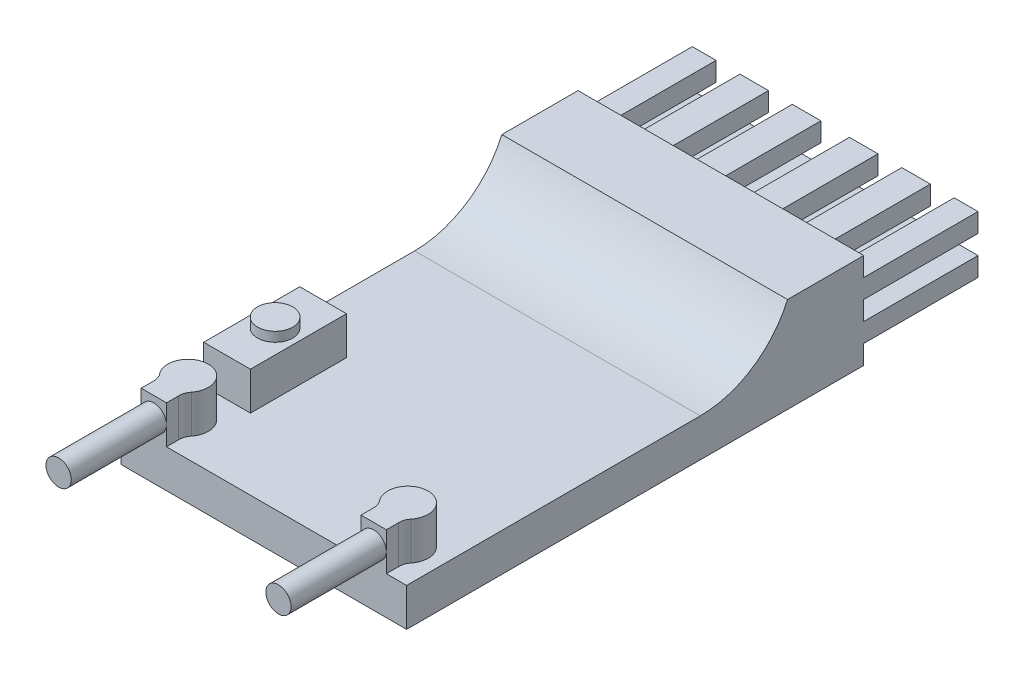
from build123d import *

# Parameters (mm, degrees)
SKETCH2_W           = 15
SKETCH2_H           = 30
BOSS_EXTRUDE1_DEPTH = 2
SKETCH3_W           = 10
SKETCH3_H           = 5
BOSS_EXTRUDE2_DEPTH = 15
SKETCH4_W           = 6
SKETCH4_H           = 1
CUT_EXTRUDE1_DEPTH  = 15
SKETCH5_W           = 1.25
SKETCH5_H           = 6
SKETCH5_W_2         = 0.75
CUT_EXTRUDE2_DEPTH  = 18.24093965
FILLET1_R           = 5
BOSS_EXTRUDE3_DEPTH = 2
SKETCH7_R           = 0.66453872
BOSS_EXTRUDE4_DEPTH = 5
SKETCH8_W           = 2.454634116
SKETCH8_H           = 5.043768733
BOSS_EXTRUDE5_DEPTH = 2
SKETCH9_R           = 0.923137451
BOSS_EXTRUDE6_DEPTH = 0.5


with BuildPart() as part:
    # Sketch2 → Boss-Extrude1 (new body)
    with BuildSketch(Plane(origin=(0, 0, 0), x_dir=(1, 0, 0), z_dir=(0, 1, 0))):
        Rectangle(SKETCH2_W, SKETCH2_H)
    extrude(amount=BOSS_EXTRUDE1_DEPTH)

    # Sketch3 → Boss-Extrude2 (add)
    with BuildSketch(Plane(origin=(7.5, 0, 0), x_dir=(0, 0, -1), z_dir=(1, 0, 0))):
        with Locations((10, 2.5)):
            Rectangle(SKETCH3_W, SKETCH3_H)
    extrude(amount=-BOSS_EXTRUDE2_DEPTH)

    # Sketch4 → Cut-Extrude1 (cut)
    with BuildSketch(Plane(origin=(7.5, 0, 0), x_dir=(0, 0, -1), z_dir=(1, 0, 0))):
        with Locations((12, 0.5)):
            Rectangle(SKETCH4_W, SKETCH4_H)
        with Locations((12, 2.5)):
            Rectangle(SKETCH4_W, SKETCH4_H)
        with Locations((12, 4.5)):
            Rectangle(SKETCH4_W, SKETCH4_H)
    extrude(amount=-CUT_EXTRUDE1_DEPTH, mode=Mode.SUBTRACT)

    # Sketch5 → Cut-Extrude2 (cut, through all)
    with BuildSketch(Plane(origin=(0, 4, 0), x_dir=(1, 0, 0), z_dir=(0, 1, 0))):
        with Locations((5.625, 12)):
            Rectangle(SKETCH5_W, SKETCH5_H)
        with Locations((2.875, 12)):
            Rectangle(SKETCH5_W, SKETCH5_H)
        with Locations((0.375, 12)):
            Rectangle(SKETCH5_W_2, SKETCH5_H)
        with Locations((-0.375, 12)):
            Rectangle(SKETCH5_W_2, SKETCH5_H)
        with Locations((-2.875, 12)):
            Rectangle(SKETCH5_W, SKETCH5_H)
        with Locations((-5.625, 12)):
            Rectangle(SKETCH5_W, SKETCH5_H)
    extrude(amount=-CUT_EXTRUDE2_DEPTH, mode=Mode.SUBTRACT)

    # Fillet1
    # the kernel refuses this fillet: 5 mm, written as the material it adds along each edge
    with BuildSketch(Plane(origin=(-7.5, 2, -5), x_dir=(0, 1, 0), z_dir=(1, 0, 0))) as fillet1_piece_1:
        with BuildLine():
            CenterArc((5, 4.582575695), FILLET1_R, 180, 66.421821522)
            Line((0, 4.582575695), (-0.1, 4.582575695))
            Line((-0.1, 4.582575695), (-0.1, 0))
            Line((-0.1, 0), (0, -0.1))
            ThreePointArc((0, -0.1), (1.5, -0.1), (2.96, -0.091651514))
            Line((2.96, -0.091651514), (3, 0))
        make_face()
    extrude(amount=15)

    # Sketch6 → Boss-Extrude3 (add)
    with BuildSketch(Plane(origin=(0, 2, 0), x_dir=(1, 0, 0), z_dir=(0, 1, 0))):
        with BuildLine():
            Line((5.106120026, -14.369842053), (5.106120026, -15))
            Line((5.106120026, -15), (6.435197466, -15))
            Line((6.435197466, -15), (6.435197466, -14.369842053))
            ThreePointArc((6.435197466, -14.369842053), (6.472638981, -14.102943479), (6.600769462, -13.865837393))
            ThreePointArc((6.600769462, -13.865837393), (5.770658746, -12.141497566), (4.940548031, -13.865837393))
            ThreePointArc((4.940548031, -13.865837393), (5.068678511, -14.102943479), (5.106120026, -14.369842053))
        make_face()
        with BuildLine():
            Line((-6.435197466, -15), (-6.435197466, -14.369842053))
            ThreePointArc((-6.435197466, -14.369842053), (-6.472638981, -14.102943479), (-6.600769462, -13.865837393))
            ThreePointArc((-6.600769462, -13.865837393), (-5.770658746, -12.141497566), (-4.940548031, -13.865837393))
            ThreePointArc((-4.940548031, -13.865837393), (-5.068678511, -14.102943479), (-5.106120026, -14.369842053))
            Line((-5.106120026, -14.369842053), (-5.106120026, -15))
            Line((-5.106120026, -15), (-6.435197466, -15))
        make_face()
    extrude(amount=BOSS_EXTRUDE3_DEPTH)

    # Sketch7 → Boss-Extrude4 (add)
    with BuildSketch(Plane.XY.offset(15)):
        with Locations((-5.770658746, 3)):
            Circle(SKETCH7_R)
        with Locations((5.770658746, 3)):
            Circle(SKETCH7_R)
    extrude(amount=BOSS_EXTRUDE4_DEPTH)

    # Sketch8 → Boss-Extrude5 (add)
    with BuildSketch(Plane(origin=(0, 2, 0), x_dir=(1, 0, 0), z_dir=(0, 1, 0))):
        with Locations((-5.659720594, -8.745923689)):
            Rectangle(SKETCH8_W, SKETCH8_H)
    extrude(amount=BOSS_EXTRUDE5_DEPTH)

    # Sketch9 → Boss-Extrude6 (add)
    with BuildSketch(Plane(origin=(0, 4, 0), x_dir=(1, 0, 0), z_dir=(0, 1, 0))):
        with Locations(Location((-5.659720594, -8.745923689, 0), (0, 0, 270))):
            Circle(SKETCH9_R)
    extrude(amount=BOSS_EXTRUDE6_DEPTH)


solid = part.part
